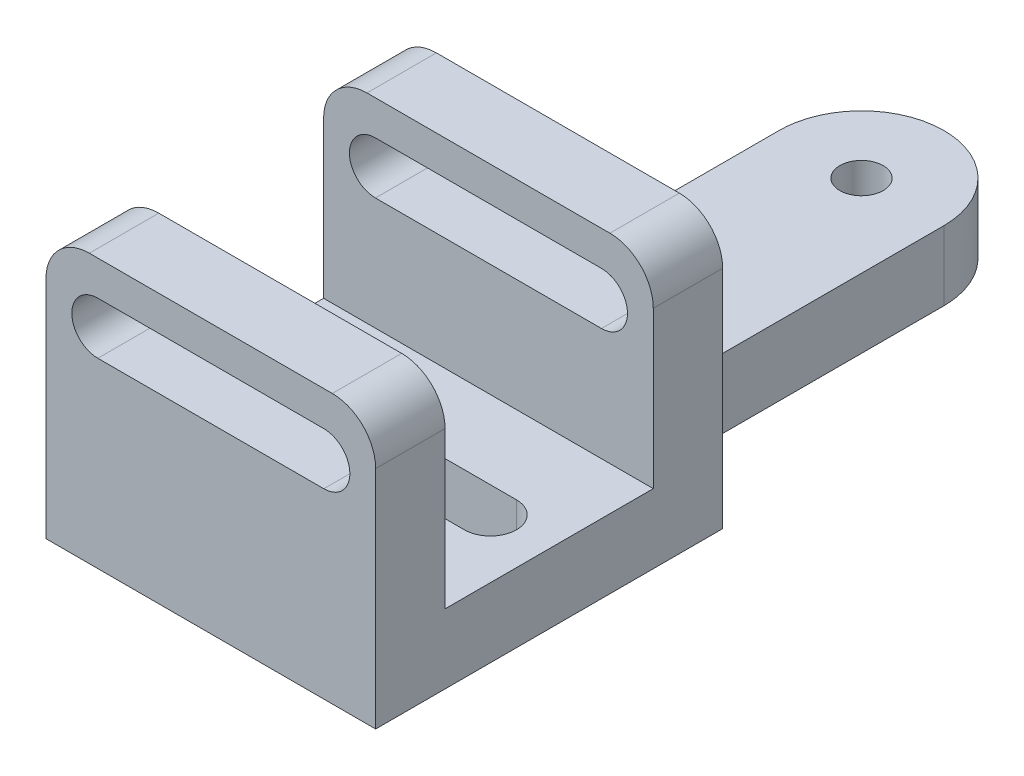
from build123d import *

# Parameters (mm, degrees)
ESTRUSIONE_ESTRUSIONE1_DEPTH = 38
RACCORDO1_R                  = 10
SCHIZZO3_W                   = 38
SCHIZZO3_H                   = 89
ESTRUSIONE_ESTRUSIONE2_DEPTH = 16
RACCORDO3_START              = -1
RACCORDO3_DEPTH              = 18
RACCORDO4_DEPTH              = 16
FORO_10_0_10_1_D             = 10
FORO_10_0_10_1_ON_FACE_2_D   = 10
TAGLIO_ESTRUSIONE1_DEPTH     = 115.93041384
TAGLIO_ESTRUSIONE2_REACH     = 144.13


with BuildPart() as part:
    # Schizzo2 → Estrusione-Estrusione1 (new, symmetric)
    with BuildSketch(Plane(origin=(0, 0, 0), x_dir=(0, 0, -1), z_dir=(1, 0, 0))):
        Polygon((-24, 16), (-24, 62), (-40, 62), (-40, 0), (40, 0), (40, 62), (24, 62), (24, 16), align=None)
    extrude(amount=ESTRUSIONE_ESTRUSIONE1_DEPTH, both=True)

    # Raccordo1
    raccordo1_edges = [part.edges().sort_by_distance(p)[0] for p in [
        (-38, 62, -32),
        (38, 62, -32),
        (38, 62, 32),
        (-38, 62, 32),
    ]]
    fillet(raccordo1_edges, radius=RACCORDO1_R)

    # Schizzo3 → Estrusione-Estrusione2 (add)
    with BuildSketch(Plane.XZ):
        with Locations((0, -84.5)):
            Rectangle(SCHIZZO3_W, SCHIZZO3_H)
    extrude(amount=-ESTRUSIONE_ESTRUSIONE2_DEPTH)

    # Raccordo3: read off the stored shape, not the designer's step
    # Raccordo3 outline → Raccordo3 (cut)
    with BuildSketch(Plane(origin=(0, 0, 0), x_dir=(1, 0, 0), z_dir=(0, 1, 0)).offset(RACCORDO3_START)):
        with BuildLine():
            Line((-19, 129), (-19, 110))
            add(Edge.make_bspline(
                [(-19, 110), (-19, 129), (0, 129)],
                knots=[0, 0, 0, 1, 1, 1], degree=2, weights=[1, 0.707106781, 1]))
            Line((0, 129), (-19, 129))
        make_face()
        with BuildLine():
            Line((19, 129), (0, 129))
            add(Edge.make_bspline(
                [(0, 129), (19, 129), (19, 110)],
                knots=[0, 0, 0, 1, 1, 1], degree=2, weights=[1, 0.707106781, 1]))
            Line((19, 110), (19, 129))
        make_face()
    extrude(amount=RACCORDO3_DEPTH, mode=Mode.SUBTRACT)

    # Raccordo4: read off the stored shape, not the designer's step
    # Raccordo4 outline → Raccordo4 (add)
    with BuildSketch(Plane(origin=(0, 0, 0), x_dir=(1, 0, 0), z_dir=(0, 1, 0))):
        with BuildLine():
            Line((19, 54), (19, 40))
            Line((19, 40), (33, 40))
            add(Edge.make_bspline(
                [(19, 54), (19, 40), (33, 40)],
                knots=[0, 0, 0, 1, 1, 1], degree=2, weights=[1, 0.707106781, 1]))
        make_face()
        with BuildLine():
            add(Edge.make_bspline(
                [(-33, 40), (-19, 40), (-19, 54)],
                knots=[0, 0, 0, 1, 1, 1], degree=2, weights=[1, 0.707106781, 1]))
            Line((-33, 40), (-19, 40))
            Line((-19, 40), (-19, 54))
        make_face()
    extrude(amount=RACCORDO4_DEPTH)

    # Foro Ø10.0 (10)-1 (through all)
    with Locations(Plane(origin=(4.7e-08, 16, -110.000000174), x_dir=(0, 0, 1), z_dir=(0, 1, 0))):
        with Locations((0, 0)):
            Hole(FORO_10_0_10_1_D / 2)

    # Foro Ø10.0 (10)-1 on face 2 (through all)
    with Locations(Plane(origin=(0, 0, -110), x_dir=(0, 0, -1), z_dir=(0, -1, 0))):
        with Locations((0, 0)):
            Hole(FORO_10_0_10_1_ON_FACE_2_D / 2)

    # Schizzo5 → Taglio-Estrusione1 (cut, through all)
    with BuildSketch(Plane(origin=(0, 0, -40), x_dir=(-1, 0, 0), z_dir=(0, 0, -1))):
        with BuildLine():
            Line((-26.051804846, 54), (26.051804846, 54))
            ThreePointArc((26.051804846, 54), (32.051804846, 48), (26.051804846, 42))
            Line((26.051804846, 42), (-26.051804846, 42))
            ThreePointArc((-26.051804846, 42), (-32.051804846, 48), (-26.051804846, 54))
        make_face()
    extrude(amount=-TAGLIO_ESTRUSIONE1_DEPTH, mode=Mode.SUBTRACT)

    # Schizzo6 → Taglio-Estrusione2 (cut, up to next)
    with BuildSketch(Plane(origin=(0, 16, 0), x_dir=(1, 0, 0), z_dir=(0, 1, 0)), mode=Mode.PRIVATE) as taglio_estrusione2_sk1:
        with BuildLine():
            Line((-25.97197238, 6), (24.454717483, 6))
            ThreePointArc((24.454717483, 6), (30.454717483, 0), (24.454717483, -6))
            Line((24.454717483, -6), (-25.97197238, -6))
            ThreePointArc((-25.97197238, -6), (-31.97197238, 0), (-25.97197238, 6))
        make_face()
    taglio_estrusione2_tool1 = extrude(taglio_estrusione2_sk1.sketch, amount=-TAGLIO_ESTRUSIONE2_REACH, mode=Mode.PRIVATE) & part.part
    add(taglio_estrusione2_tool1.solids().sort_by_distance((-0.758627, 16, 0))[0], mode=Mode.SUBTRACT)


solid = part.part
